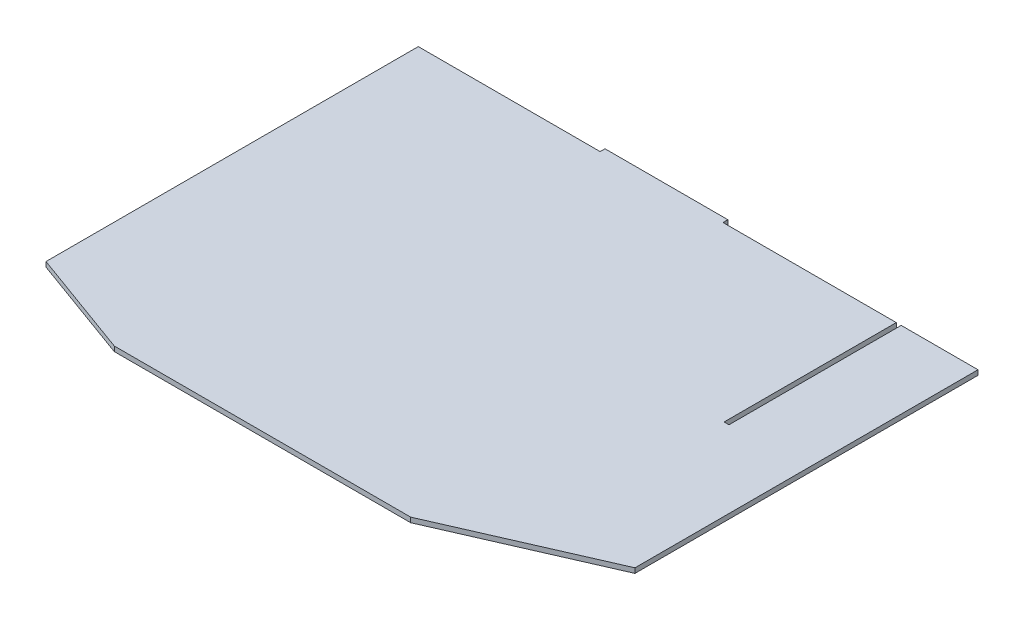
from build123d import *

# Parameters (mm, degrees)
SKETCH1_W           = 311.277
SKETCH1_H           = 3.175
BOSS_EXTRUDE1_DEPTH = 267.83
SKETCH3_W           = 155.702
SKETCH3_H           = 3.175
BOSS_EXTRUDE3_DEPTH = 3.175
SKETCH4_W           = 50.038
SKETCH4_H           = 3.175
BOSS_EXTRUDE4_DEPTH = 267.83
CUT_EXTRUDE1_DEPTH  = 340.649729247
SKETCH8_W           = 80
SKETCH8_H           = 3.175
BOSS_EXTRUDE6_DEPTH = 3.175
CUT_EXTRUDE3_DEPTH  = 340.649729247


with BuildPart() as part:
    # Sketch1 → Boss-Extrude1 (new body)
    with BuildSketch(Plane.XY):
        Rectangle(SKETCH1_W, SKETCH1_H)
    extrude(amount=BOSS_EXTRUDE1_DEPTH)

    # Sketch3 → Boss-Extrude3 (add)
    with BuildSketch(Plane(origin=(155.6385, 0, 0), x_dir=(0, 0, -1), z_dir=(1, 0, 0))):
        with Locations((-189.979, 0)):
            Rectangle(SKETCH3_W, SKETCH3_H)
    extrude(amount=BOSS_EXTRUDE3_DEPTH)

    # Sketch4 → Boss-Extrude4 (add)
    with BuildSketch(Plane.XY.offset(267.83)):
        with Locations((183.8325, 0)):
            Rectangle(SKETCH4_W, SKETCH4_H)
    extrude(amount=-BOSS_EXTRUDE4_DEPTH)

    # Sketch6 → Cut-Extrude1 (cut, through all)
    with BuildSketch(Plane(origin=(0, 1.5875, 0), x_dir=(1, 0, 0), z_dir=(0, 1, 0))):
        Polygon((208.8515, -223.38), (107.2515, -267.83), (208.8515, -267.83), align=None)
    extrude(amount=-CUT_EXTRUDE1_DEPTH, mode=Mode.SUBTRACT)

    # Sketch8 → Boss-Extrude6 (add)
    with BuildSketch(Plane(origin=(0, 0, 0), x_dir=(-1, 0, 0), z_dir=(0, 0, -1))):
        with Locations((-2.78399998, 0)):
            Rectangle(SKETCH8_W, SKETCH8_H)
    extrude(amount=BOSS_EXTRUDE6_DEPTH)

    # Sketch11 → Cut-Extrude3 (cut, through all)
    with BuildSketch(Plane.XZ.offset(1.5875)):
        Polygon((-155.6385, 242.43), (-85.7885, 267.83), (-155.6385, 267.83), align=None)
    extrude(amount=-CUT_EXTRUDE3_DEPTH, mode=Mode.SUBTRACT)


solid = part.part
